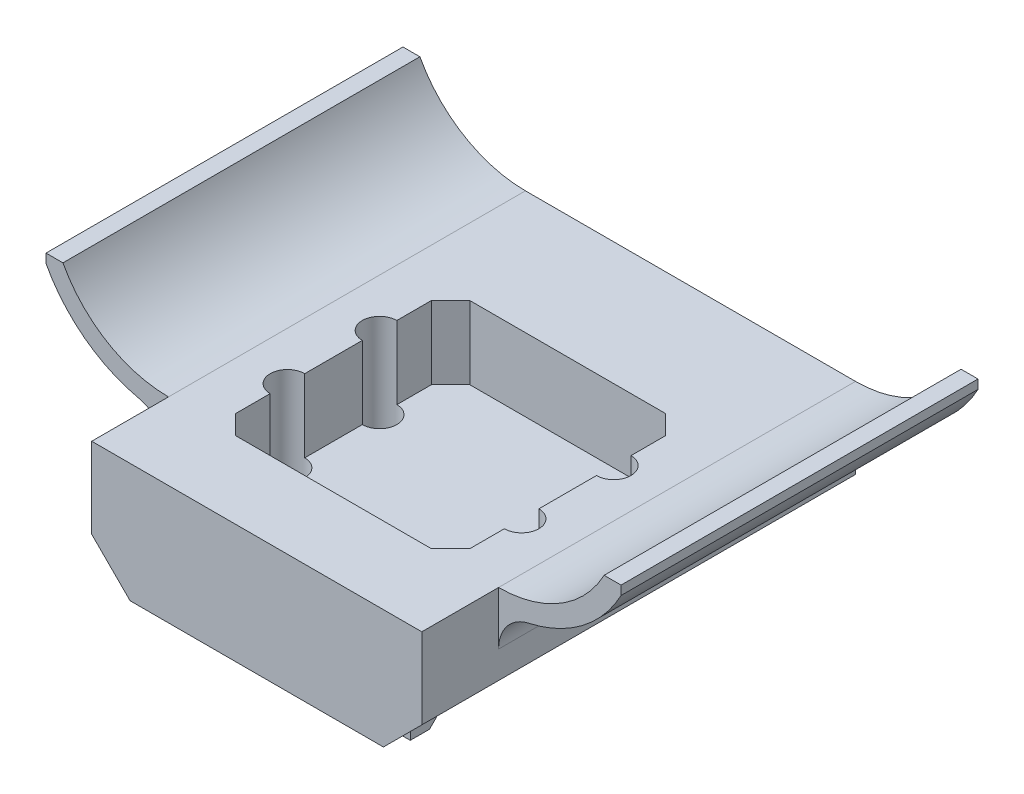
from build123d import *

# Parameters (mm, degrees)
ESQUISSE1_W             = 17.2
ESQUISSE1_H             = 22.6
BOSS_EXTRU_1_DEPTH      = 6.2
ENL_V_MAT_EXTRU_1_DEPTH = 3.8
ESQUISSE3_R             = 0.9
ENL_V_MAT_EXTRU_2_DEPTH = 25.477744994
CHANFREIN1_SIZE         = 2
BOSS_EXTRU_2_DEPTH      = 18.6
BOSS_EXTRU_3_DEPTH      = 4
CONG_1_R                = 2


with BuildPart() as part:
    # Esquisse1 → Boss.-Extru.1 (new body)
    with BuildSketch(Plane(origin=(0, 0, 0), x_dir=(1, 0, 0), z_dir=(0, 1, 0))):
        with Locations((0, 11.3)):
            Rectangle(ESQUISSE1_W, ESQUISSE1_H)
    extrude(amount=BOSS_EXTRU_1_DEPTH)

    # Esquisse2 → Enlèv. mat.-Extru.1 (cut)
    with BuildSketch(Plane(origin=(0, 6.2, 0), x_dir=(1, 0, 0), z_dir=(0, 1, 0))):
        with BuildLine():
            Line((-5.1, 4), (5.1, 4))
            Line((5.1, 4), (6.1, 5))
            Line((6.1, 5), (6.1, 6.8))
            ThreePointArc((6.1, 6.8), (7, 7.7), (6.1, 8.6))
            Line((6.1, 8.6), (6.1, 11.6))
            ThreePointArc((6.1, 11.6), (7, 12.5), (6.1, 13.4))
            Line((6.1, 13.4), (6.1, 15.2))
            Line((6.1, 15.2), (5.1, 16.2))
            Line((5.1, 16.2), (-5.1, 16.2))
            Line((-5.1, 16.2), (-6.1, 15.2))
            Line((-6.1, 15.2), (-6.1, 13.4))
            ThreePointArc((-6.1, 13.4), (-7, 12.5), (-6.1, 11.6))
            Line((-6.1, 11.6), (-6.1, 8.6))
            ThreePointArc((-6.1, 8.6), (-7, 7.7), (-6.1, 6.8))
            Line((-6.1, 6.8), (-6.1, 5))
            Line((-6.1, 5), (-5.1, 4))
        make_face()
    extrude(amount=-ENL_V_MAT_EXTRU_1_DEPTH, mode=Mode.SUBTRACT)

    # Esquisse3 → Enlèv. mat.-Extru.2 (cut, through all)
    with BuildSketch(Plane(origin=(0, 2.4, 0), x_dir=(1, 0, 0), z_dir=(0, 1, 0))):
        with Locations(Location((6.1, 12.5, 0), (0, 0, 270))):
            Circle(ESQUISSE3_R)
        with Locations(Location((-6.1, 12.5, 0), (0, 0, 270))):
            Circle(ESQUISSE3_R)
        with Locations(Location((-6.1, 7.7, 0), (0, 0, 270))):
            Circle(ESQUISSE3_R)
        with Locations(Location((6.1, 7.7, 0), (0, 0, 270))):
            Circle(ESQUISSE3_R)
    extrude(amount=-ENL_V_MAT_EXTRU_2_DEPTH, mode=Mode.SUBTRACT)

    # Chanfrein1
    # the kernel refuses this chamfer: 2 mm, written as the material it takes off along each edge
    with BuildSketch(Plane(origin=(13.743365976, 0, -22.6), x_dir=(0, -0.02749587661058639, 0.9996219169112968), z_dir=(-1, 0, 0))) as chanfrein1_piece_1:
        Polygon((CHANFREIN1_SIZE * 0.999621916911, CHANFREIN1_SIZE * 0.0274958766106), (-CHANFREIN1_SIZE * 0.0274958766106, CHANFREIN1_SIZE * 0.999621916911), (0, 0), align=None)
    extrude(amount=27.486731952, mode=Mode.SUBTRACT)
    with BuildSketch(Plane(origin=(8.6, 0, 5.143365976), x_dir=(0.027495876610586494, 0.9996219169112968, 0), z_dir=(0, 0, -1)), Plane(origin=(-8.6, 0, -27.743365976), x_dir=(-0.027495876610586494, 0.9996219169112968, 0), z_dir=(0, 0, 1))) as chanfrein1_piece_2:
        Polygon((CHANFREIN1_SIZE * 0.999621916911, -CHANFREIN1_SIZE * 0.0274958766106), (-CHANFREIN1_SIZE * 0.0274958766106, -CHANFREIN1_SIZE * 0.999621916911), (0, 0), align=None)
    extrude(amount=32.886731952, mode=Mode.SUBTRACT)

    # Esquisse4 → Boss.-Extru.2 (add)
    with BuildSketch(Plane(origin=(0, 0, -22.6), x_dir=(-1, 0, 0), z_dir=(0, 0, -1))):
        with BuildLine():
            Line((-8.6, 6.2), (-8.6, 5.2))
            ThreePointArc((-8.6, 5.2), (-12.321519298, 6.230801171), (-14.982352941, 9.029411765))
            Line((-14.982352941, 9.029411765), (-14.982352941, 9.5))
            Line((-14.982352941, 9.5), (-14.1, 9.5))
            ThreePointArc((-14.1, 9.5), (-11.807023542, 7.088294096), (-8.6, 6.2))
        make_face()
    boss_extru_2 = extrude(amount=-BOSS_EXTRU_2_DEPTH)

    # Symétrie1: Boss.-Extru.2 across plane
    add(boss_extru_2.mirror(Plane(origin=(0, 0, 0), x_dir=(0, 0, 1), z_dir=(1, 0, 0))))

    # Esquisse5 → Boss.-Extru.3 (add, symmetric)
    with BuildSketch(Plane(origin=(0, 0, 0), x_dir=(0, 0, -1), z_dir=(1, 0, 0))):
        Polygon((4, 0), (8, 0), (5, -3), (4, -3), align=None)
    extrude(amount=BOSS_EXTRU_3_DEPTH, both=True)

    # Congé1
    cong_1_edges = [part.edges().sort_by_distance(p)[0] for p in [
        (8.6, 5.2, -13.3),
        (-8.6, 5.2, -13.3),
        (0, 0, -8),
    ]]
    fillet(cong_1_edges, radius=CONG_1_R)


solid = part.part
